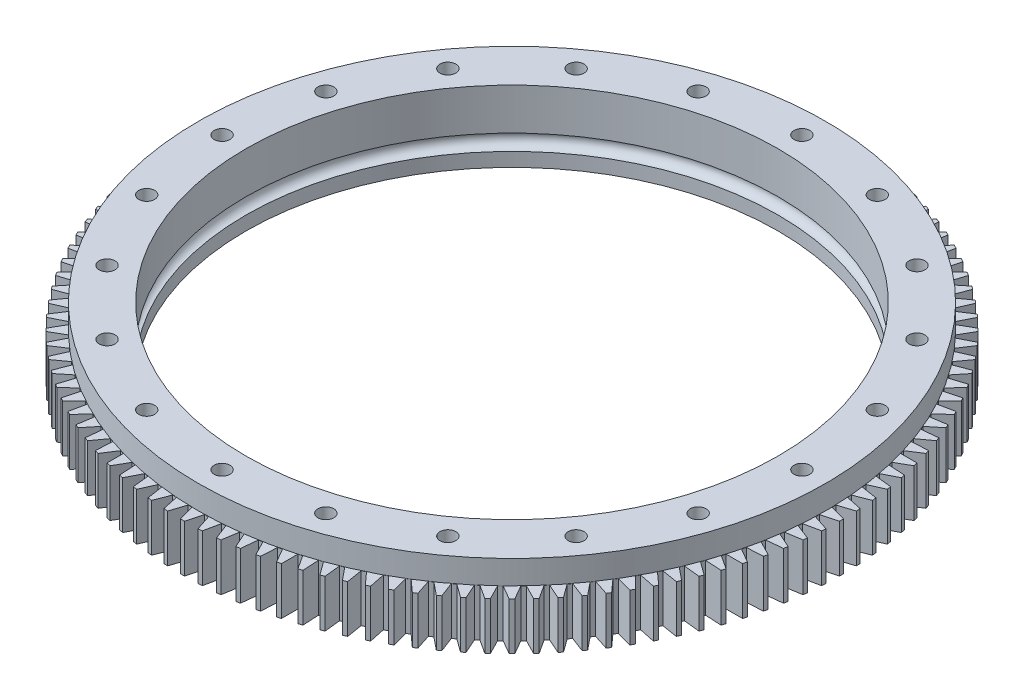
from build123d import *

# Parameters (mm, degrees)
ESQUISSE2_R                  = 10
ENL_V_MAT_EXTRU_1_DEPTH      = 30
R_P_TITION_CIRCULAIRE1_COUNT = 20
ENL_V_MAT_EXTRU_2_DEPTH      = 60
R_P_TITION_CIRCULAIRE2_COUNT = 120
ENL_V_START                  = -30
ESQUISSE5_R                  = 416
ESQUISSE5_R_2                = 396
ENL_V_MAT_EXTRU_3_DEPTH      = 30


with BuildPart() as part:
    # Esquisse1 → Révolution1 (revolve)
    with BuildSketch(Plane.XY, mode=Mode.PRIVATE) as r_volution1_sk:
        with BuildLine():
            Line((0, 37.5), (0, 90))
            Line((0, 90), (80, 90))
            Line((80, 90), (80, 0))
            Line((80, 0), (0, 0))
            Line((0, 0), (0, 17.5))
            ThreePointArc((0, 17.5), (10, 27.5), (0, 37.5))
        make_face()
    revolve(r_volution1_sk.sketch.rotate(Axis((-336, 0, 0), (0, 1, 0)), 90), axis=Axis((-336, 0, 0), (0, 1, 0)))

    # Esquisse2 → Enlèv. mat.-Extru.1 (cut)
    with BuildSketch(Plane(origin=(0, 90, 0), x_dir=(1, 0, 0), z_dir=(0, 1, 0))):
        with Locations(Location((30, 0, 0), (0, 0, 270))):
            Circle(ESQUISSE2_R)
    enl_v_mat_extru_1 = extrude(amount=-ENL_V_MAT_EXTRU_1_DEPTH, mode=Mode.SUBTRACT)

    # Répétition circulaire1: Enlèv. mat.-Extru.1 ×20 about axis
    r_p_tition_circulaire1_axis = Axis((-336, 0, 0), (0, 1, 0))
    for i in range(1, R_P_TITION_CIRCULAIRE1_COUNT):
        add(enl_v_mat_extru_1.rotate(r_p_tition_circulaire1_axis, i * 360 / R_P_TITION_CIRCULAIRE1_COUNT), mode=Mode.SUBTRACT)

    # Esquisse3 → Enlèv. mat.-Extru.2 (cut)
    with BuildSketch(Plane.XZ):
        Polygon((59.946238459, -12.869931402), (60.077168067, -7.869931402), (80.077168067, -2.498808734), (79.637726313, -19.280412258), align=None)
    enl_v_mat_extru_2 = extrude(amount=-ENL_V_MAT_EXTRU_2_DEPTH, mode=Mode.SUBTRACT)

    # Répétition circulaire2: Enlèv. mat.-Extru.2 ×120 about axis
    r_p_tition_circulaire2_axis = Axis((-336, 0, 0), (0, 1, 0))
    for i in range(1, R_P_TITION_CIRCULAIRE2_COUNT):
        add(enl_v_mat_extru_2.rotate(r_p_tition_circulaire2_axis, i * 360 / R_P_TITION_CIRCULAIRE2_COUNT), mode=Mode.SUBTRACT)

    # Esquisse5 → Enlèv. mat.-Extru.3 (cut)
    with BuildSketch(Plane(origin=(0, 90, 0), x_dir=(1, 0, 0), z_dir=(0, 1, 0)).offset(ENL_V_START)):
        with Locations((-336, 0)):
            Circle(ESQUISSE5_R)
        with Locations(Location((-336, 0, 0), (0, 0, 270))):
            Circle(ESQUISSE5_R_2, mode=Mode.SUBTRACT)
    extrude(amount=ENL_V_MAT_EXTRU_3_DEPTH, mode=Mode.SUBTRACT)


solid = part.part
